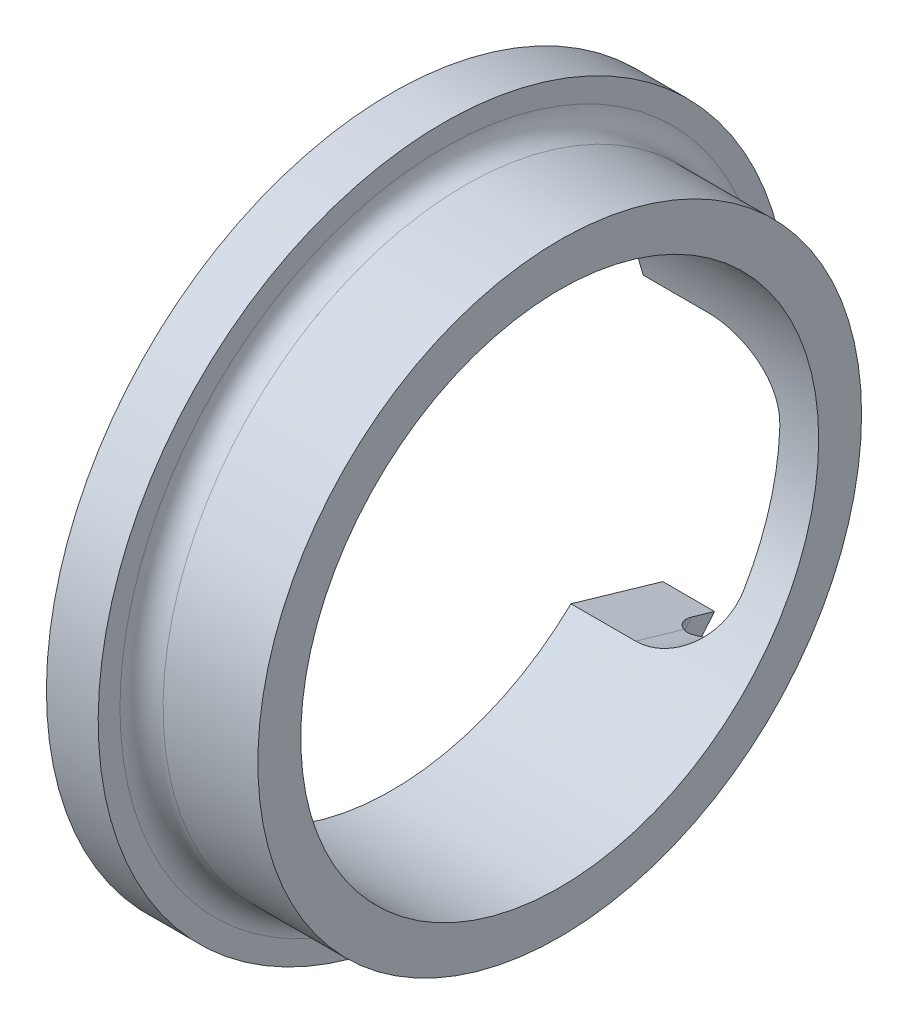
from build123d import *

# Parameters (mm, degrees)
FILLET1_R          = 0.635
CUT_EXTRUDE1_REACH = 46.205


with BuildPart() as part:
    # Sketch1 → Revolve1 (revolve)
    with BuildSketch(Plane.XY):
        Polygon((-37.854124952, 8.89), (-37.854124952, 10.166999986), (-39.378124952, 10.166999986), (-39.378124952, 7.626999986), (-34.42812497, 7.626999986), (-34.42812497, 8.89), align=None)
    revolve(axis=Axis((0, 0, 0), (-1, 0, 0)))

    # Fillet1
    fillet1_edges = [part.edges().sort_by_distance(p)[0] for p in [
        (-37.854124952, -8.89, 0),
    ]]
    fillet(fillet1_edges, radius=FILLET1_R)

    # Sketch3 → Cut-Extrude1 (cut, up to next)
    with BuildSketch(Plane(origin=(0, -1.746488682, -6.004183776), x_dir=(-1, 0, 0), z_dir=(0, -0.27930256399882136, -0.9602031439980211)), mode=Mode.PRIVATE) as cut_extrude1_sk1:
        with BuildLine():
            Line((39.378124952, 3.81), (39.378124952, -3.81))
            Line((39.378124952, -3.81), (37.473124952, -3.81))
            ThreePointArc((37.473124952, -3.81), (36.126086534, -3.252038418), (35.568124952, -1.905))
            Line((35.568124952, -1.905), (35.568124952, 1.905))
            ThreePointArc((35.568124952, 1.905), (36.126086534, 3.252038418), (37.473124952, 3.81))
            Line((37.473124952, 3.81), (39.378124952, 3.81))
        make_face()
    cut_extrude1_tool1 = extrude(cut_extrude1_sk1.sketch, amount=CUT_EXTRUDE1_REACH, mode=Mode.PRIVATE) & part.part
    add(cut_extrude1_tool1.solids().sort_by_distance((-37.557, -1.746489, -6.004184))[0], mode=Mode.SUBTRACT)


solid = part.part
